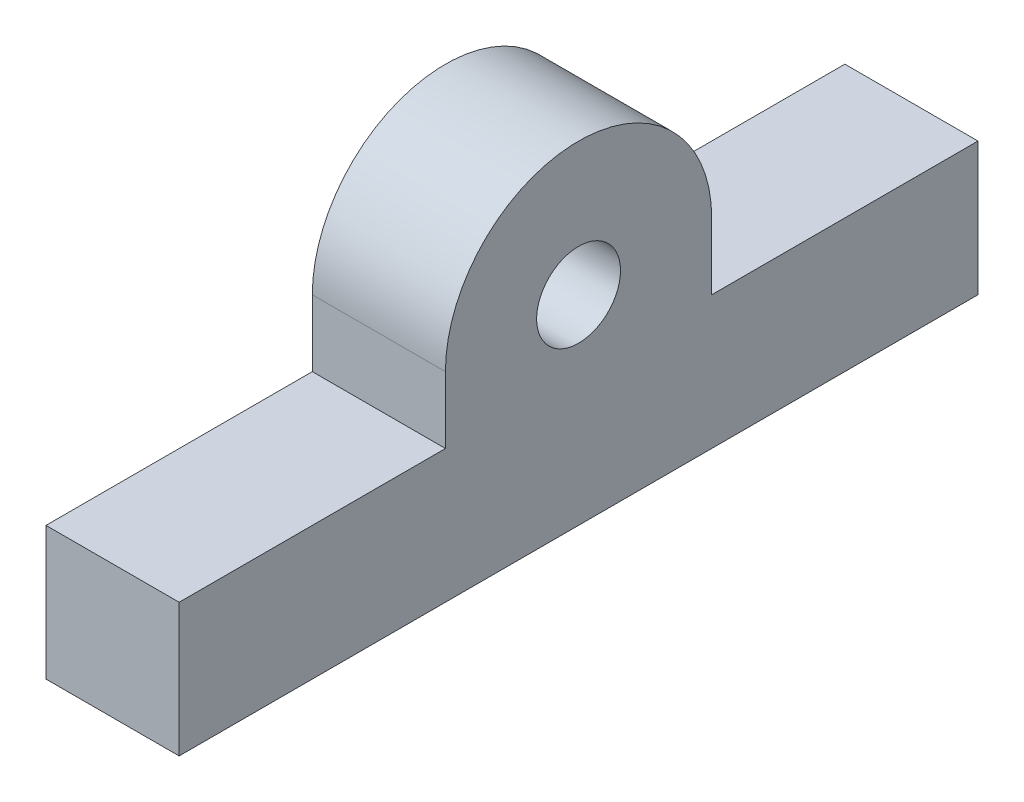
from build123d import *

# Parameters (mm, degrees)
BOSS_EXTRUDE1_DEPTH = 12.7
SKETCH2_R           = 4
CUT_EXTRUDE1_DEPTH  = 84.521209881
SKETCH3_R           = 2
CUT_EXTRUDE2_DEPTH  = 7


with BuildPart() as part:
    # Sketch1 → Boss-Extrude1 (new body)
    with BuildSketch(Plane(origin=(0, 0, 0), x_dir=(0, 0, -1), z_dir=(1, 0, 0))):
        with BuildLine():
            Line((0, 0), (76.2, 0))
            Line((76.2, 0), (76.2, 12.7))
            Line((76.2, 12.7), (50.8, 12.7))
            Line((50.8, 12.7), (50.8, 19.05))
            ThreePointArc((50.8, 19.05), (38.1, 31.75), (25.4, 19.05))
            Line((25.4, 19.05), (25.4, 12.7))
            Line((25.4, 12.7), (0, 12.7))
            Line((0, 12.7), (0, 0))
        make_face()
    extrude(amount=BOSS_EXTRUDE1_DEPTH)

    # Sketch2 → Cut-Extrude1 (cut, through all)
    with BuildSketch(Plane(origin=(12.7, 0, 0), x_dir=(0, 0, -1), z_dir=(1, 0, 0))):
        with Locations((38.1, 19.05)):
            Circle(SKETCH2_R)
    extrude(amount=-CUT_EXTRUDE1_DEPTH, mode=Mode.SUBTRACT)

    # Sketch3 → Cut-Extrude2 (cut)
    with BuildSketch(Plane.XZ):
        with Locations((6.35, -12.7)):
            Circle(SKETCH3_R)
        with Locations((6.35, -63.5)):
            Circle(SKETCH3_R)
    extrude(amount=-CUT_EXTRUDE2_DEPTH, mode=Mode.SUBTRACT)


solid = part.part
